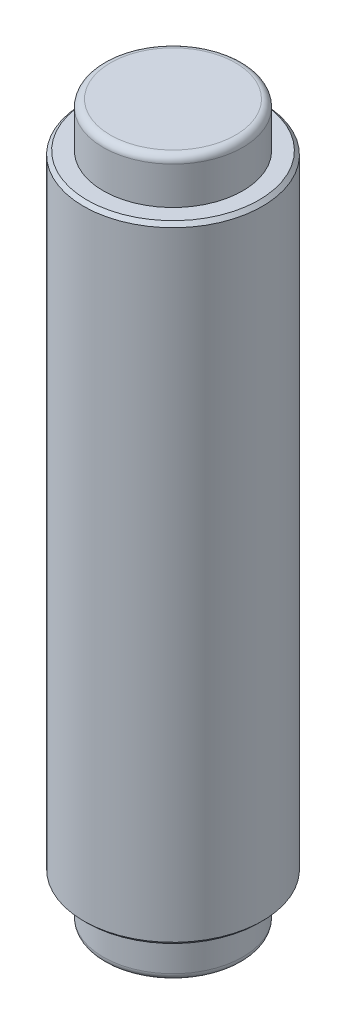
from build123d import *

# Parameters (mm, degrees)
SKETCH1_R           = 3.9
BOSS_EXTRUDE1_DEPTH = 40
FILLET5_R           = 0.4
SKETCH2_R           = 5
BOSS_EXTRUDE2_DEPTH = 17.5
CHAMFER1_SIZE       = 0.2
CHAMFER2_SIZE       = 0.2


with BuildPart() as part:
    # Sketch1 → Boss-Extrude1 (new body)
    with BuildSketch(Plane(origin=(0, 0, 0), x_dir=(1, 0, 0), z_dir=(0, 1, 0))):
        Circle(SKETCH1_R)
    extrude(amount=BOSS_EXTRUDE1_DEPTH)

    # Fillet5
    fillet5_edges = [part.edges().sort_by_distance(p)[0] for p in [
        (-3.9, 0, 0),
        (-3.9, 40, 0),
    ]]
    fillet(fillet5_edges, radius=FILLET5_R)

    # Sketch2 → Boss-Extrude2 (add, symmetric)
    with BuildSketch(Plane(origin=(0, 20, 0), x_dir=(1, 0, 0), z_dir=(0, 1, 0))):
        Circle(SKETCH2_R)
    extrude(amount=BOSS_EXTRUDE2_DEPTH, both=True)

    # Chamfer1
    chamfer1_edges = [part.edges().sort_by_distance(p)[0] for p in [
        (-5, 2.5, 0),
    ]]
    chamfer(chamfer1_edges, length=CHAMFER1_SIZE)

    # Chamfer2
    chamfer2_edges = [part.edges().sort_by_distance(p)[0] for p in [
        (-5, 37.5, 0),
    ]]
    chamfer(chamfer2_edges, length=CHAMFER2_SIZE)


solid = part.part
